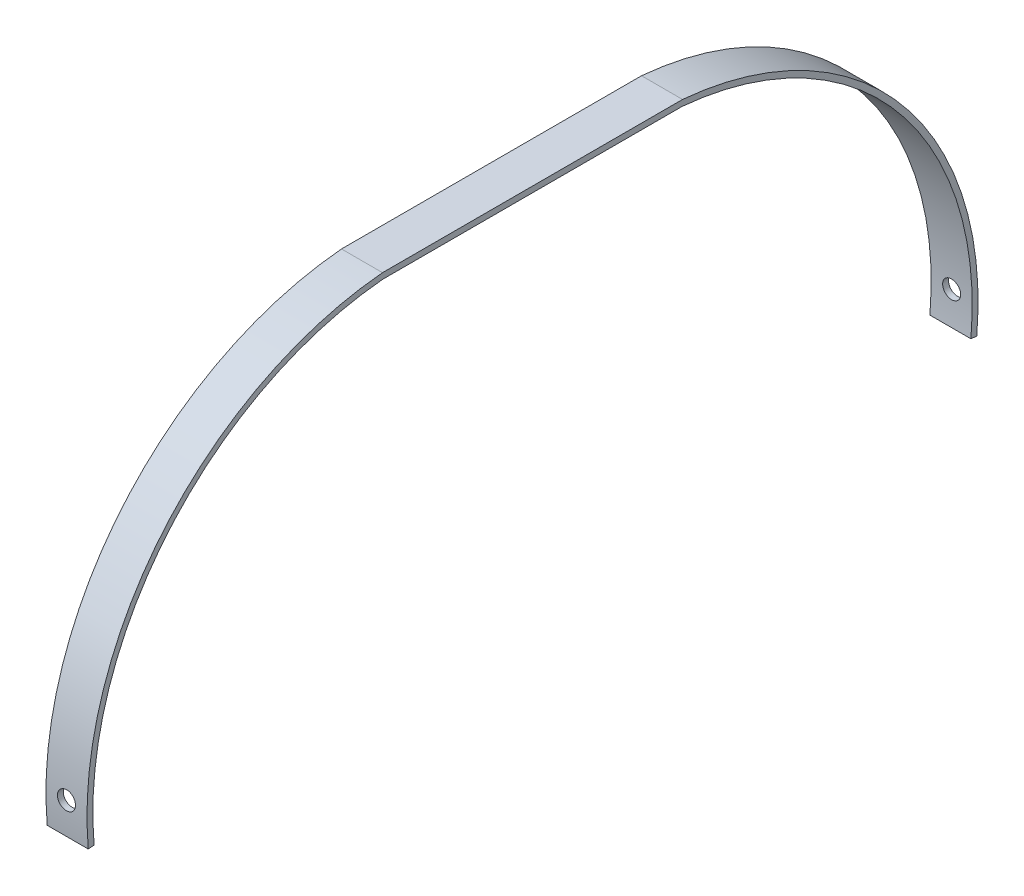
from build123d import *

# Parameters (mm, degrees)
BOSS_EXTRUDE1_DEPTH     = 17.78
CUT_EXTRUDE1_DEPTH      = 246.907249488
CUT_EXTRUDE1_DEPTH_BACK = 246.907249488
SKETCH2_R               = 3.914165929


with BuildPart() as part:
    # Sketch1 → Boss-Extrude1 (new body)
    with BuildSketch(Plane(origin=(0, 0, 0), x_dir=(0, 0, -1), z_dir=(1, 0, 0))):
        with BuildLine():
            Line((65, 1.27), (-65, 1.27))
            ThreePointArc((-65, 1.27), (-160.342068402, -48.593885399), (-192.5, -151.27))
            Line((-192.5, -151.27), (-189.970093401, -151.043786383))
            ThreePointArc((-189.970093401, -151.043786383), (-158.429364067, -50.266130166), (-64.886150372, -1.27))
            Line((-64.886150372, -1.27), (64.886150372, -1.27))
            ThreePointArc((64.886150372, -1.27), (158.429364067, -50.266130166), (189.970093401, -151.043786383))
            Line((189.970093401, -151.043786383), (192.5, -151.27))
            ThreePointArc((192.5, -151.27), (160.342068402, -48.593885399), (65, 1.27))
        make_face()
    extrude(amount=BOSS_EXTRUDE1_DEPTH)

    # Sketch2 → Cut-Extrude1 (cut, two sides: drawn at the far end of the back side and taken through both)
    with BuildSketch(Plane.XY.offset(-CUT_EXTRUDE1_DEPTH_BACK)):
        with Locations((8.89, -137.16)):
            Circle(SKETCH2_R)
    extrude(amount=CUT_EXTRUDE1_DEPTH + CUT_EXTRUDE1_DEPTH_BACK, mode=Mode.SUBTRACT)


solid = part.part
